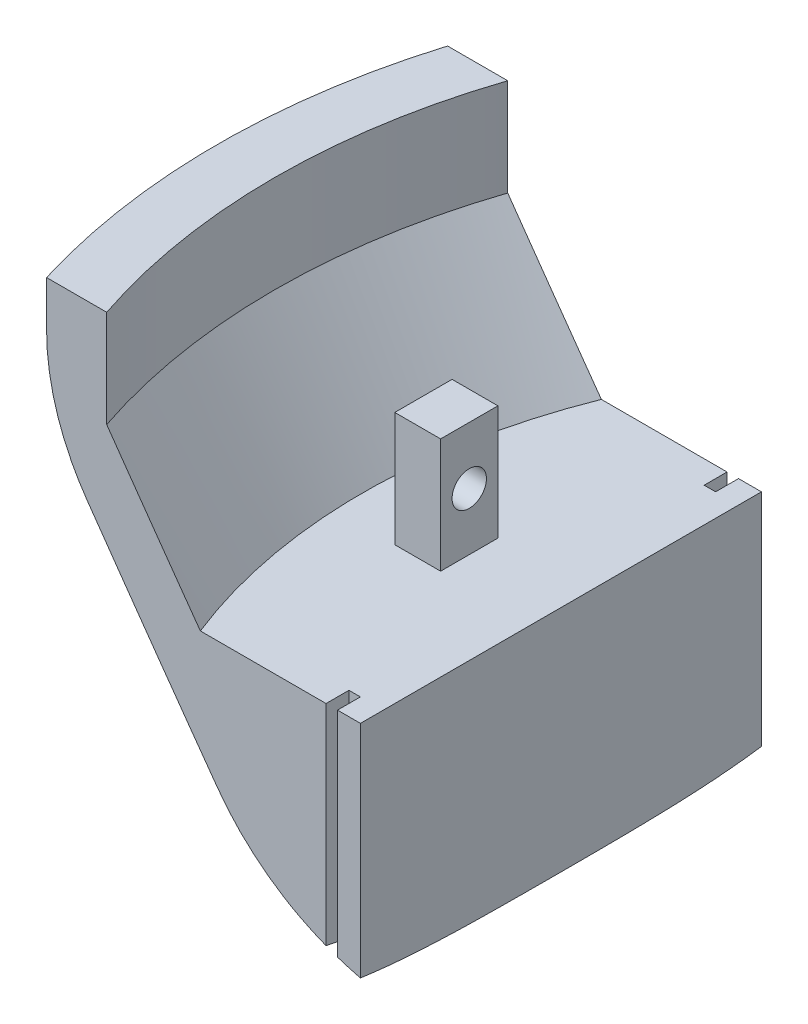
from build123d import *

# Parameters (mm, degrees)
SKETCH3_R           = 60
BOSS_EXTRUDE2_DEPTH = 150
CHAMFER2_SIZE       = 20
CHAMFER2_SIZE2      = 30
FILLET2_R           = 20
CUT_EXTRUDE1_DEPTH  = 75
CUT_EXTRUDE3_DEPTH  = 75
SKETCH8_W           = 4
SKETCH8_H           = 5
BOSS_EXTRUDE3_DEPTH = 10
SKETCH9_R           = 1.5
CUT_EXTRUDE4_DEPTH  = 4
SKETCH10_W          = 1
SKETCH10_H          = 20
CUT_EXTRUDE5_DEPTH  = 2
SKETCH11_W          = 1
SKETCH11_H          = 20.415031328
CUT_EXTRUDE6_DEPTH  = 2


# Read off the part's stored shape, not the designer's step: Shell1
with BuildPart() as part:
    # Sketch3 → Boss-Extrude2 (new body)
    with BuildSketch(Plane(origin=(0, 0, 0), x_dir=(1, 0, 0), z_dir=(0, 1, 0))):
        with Locations(Location((0, 0, 0), (0, 0, 270))):
            Circle(SKETCH3_R)
    extrude(amount=BOSS_EXTRUDE2_DEPTH)

    # Chamfer2
    chamfer2_edges = [part.edges().sort_by_distance(p)[0] for p in [
        (0, 0, -60),
    ]]
    chamfer2_side = [part.faces().sort_by_distance(p)[0] for p in [
        (0, 0, 0),
    ]]
    chamfer(chamfer2_edges, length=CHAMFER2_SIZE, length2=CHAMFER2_SIZE2, reference=chamfer2_side[0])

    # Shell1 outline → Shell1 (revolve, cut)
    with BuildSketch(Plane.XY):
        Polygon((55, 31.513878189), (55, 150), (0, 150), (0, 20), (47.324081208, 20), align=None)
    revolve(axis=Axis((0, 0, 0), (0, 1, 0)), mode=Mode.SUBTRACT)

    # Fillet2
    fillet2_edges = [part.edges().sort_by_distance(p)[0] for p in [
        (0, 30, -60),
        (0, 0, -40),
    ]]
    fillet(fillet2_edges, radius=FILLET2_R)

    # Sketch5 → Cut-Extrude1 (cut, symmetric)
    with BuildSketch(Plane(origin=(0, 0, 0), x_dir=(0, 0, -1), z_dir=(1, 0, 0))):
        Polygon((17.5, 40), (-17.5, 40), (-17.5, 0), (-70.196325884, 0), (-70.196325884, 156.197242627), (69.410546117, 156.197242627), (69.410546117, 0), (17.5, 0), align=None)
    extrude(amount=CUT_EXTRUDE1_DEPTH, both=True, mode=Mode.SUBTRACT)

    # Sketch7 → Cut-Extrude3 (cut, symmetric)
    with BuildSketch(Plane.XY):
        Polygon((-30, 49.792958937), (-30, -7.364185111), (-30, -11.493100616), (77.720762444, -11.493100616), (77.720762444, 49.792958937), align=None)
    extrude(amount=CUT_EXTRUDE3_DEPTH, both=True, mode=Mode.SUBTRACT)

    # Sketch8 → Boss-Extrude3 (add)
    with BuildSketch(Plane(origin=(0, 20, 0), x_dir=(1, 0, 0), z_dir=(0, 1, 0))):
        with Locations((-40, 0)):
            Rectangle(SKETCH8_W, SKETCH8_H)
    extrude(amount=BOSS_EXTRUDE3_DEPTH)

    # Sketch9 → Cut-Extrude4 (cut)
    with BuildSketch(Plane(origin=(-38, 0, 0), x_dir=(0, 0, -1), z_dir=(1, 0, 0))):
        with Locations((0, 25)):
            Circle(SKETCH9_R)
    extrude(amount=-CUT_EXTRUDE4_DEPTH, mode=Mode.SUBTRACT)

    # Sketch10 → Cut-Extrude5 (cut)
    with BuildSketch(Plane.XY.offset(17.5)):
        with Locations((-32.5, 10)):
            Rectangle(SKETCH10_W, SKETCH10_H)
    extrude(amount=-CUT_EXTRUDE5_DEPTH, mode=Mode.SUBTRACT)

    # Sketch11 → Cut-Extrude6 (cut)
    with BuildSketch(Plane(origin=(0, 0, -17.5), x_dir=(-1, 0, 0), z_dir=(0, 0, -1))):
        with Locations((32.5, 9.792484336)):
            Rectangle(SKETCH11_W, SKETCH11_H)
    extrude(amount=-CUT_EXTRUDE6_DEPTH, mode=Mode.SUBTRACT)


solid = part.part
